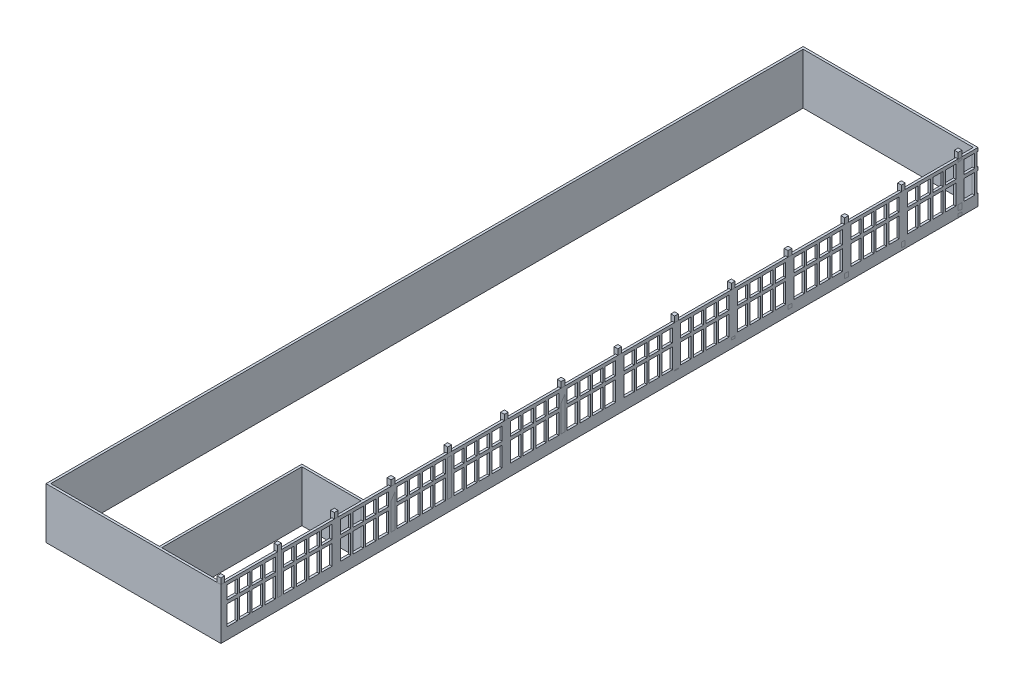
from build123d import *

# Parameters (mm, degrees)
SKETCH1_W                  = 18500
SKETCH1_H                  = 80100
SKETCH1_W_2                = 18000
SKETCH1_H_2                = 79600
BOSS_EXTRUDE1_DEPTH        = 5400
SKETCH3_W                  = 400
SKETCH3_H                  = 400
BOSS_EXTRUDE3_DEPTH        = 6000
LPATTERN1_COUNT            = 14
LPATTERN1_PITCH            = 6000
SKETCH6_W                  = 1100
SKETCH6_H                  = 2100
SKETCH6_H_2                = 1400
CUT_EXTRUDE1_DEPTH         = 1290
LPATTERN2_COUNT            = 4
LPATTERN2_PITCH            = 1340
MIRROR1_COPY_1_SKETCH_W    = 1100
MIRROR1_COPY_1_SKETCH_H    = 2100
MIRROR1_COPY_1_SKETCH_H_2  = 1400
MIRROR1_COPY_1_DEPTH       = 1290
MIRROR1_COPY_2_SKETCH_W    = 1100
MIRROR1_COPY_2_SKETCH_H    = 2100
MIRROR1_COPY_2_SKETCH_H_2  = 1400
MIRROR1_COPY_2_DEPTH       = 1290
MIRROR1_COPY_3_SKETCH_W    = 1100
MIRROR1_COPY_3_SKETCH_H    = 2100
MIRROR1_COPY_3_SKETCH_H_2  = 1400
MIRROR1_COPY_3_DEPTH       = 1290
MIRROR2_COPY_1_SKETCH_W    = 1100
MIRROR2_COPY_1_SKETCH_H    = 2100
MIRROR2_COPY_1_SKETCH_H_2  = 1400
MIRROR2_COPY_1_DEPTH       = 1290
MIRROR2_COPY_2_SKETCH_W    = 1100
MIRROR2_COPY_2_SKETCH_H    = 2100
MIRROR2_COPY_2_SKETCH_H_2  = 1400
MIRROR2_COPY_2_DEPTH       = 1290
MIRROR2_COPY_3_SKETCH_W    = 1100
MIRROR2_COPY_3_SKETCH_H    = 2100
MIRROR2_COPY_3_SKETCH_H_2  = 1400
MIRROR2_COPY_3_DEPTH       = 1290
MIRROR2_COPY_4_SKETCH_W    = 1100
MIRROR2_COPY_4_SKETCH_H    = 2100
MIRROR2_COPY_4_SKETCH_H_2  = 1400
MIRROR2_COPY_4_DEPTH       = 1290
MIRROR2_COPY_5_SKETCH_W    = 1100
MIRROR2_COPY_5_SKETCH_H    = 2100
MIRROR2_COPY_5_SKETCH_H_2  = 1400
MIRROR2_COPY_5_DEPTH       = 1290
MIRROR2_COPY_6_SKETCH_W    = 1100
MIRROR2_COPY_6_SKETCH_H    = 2100
MIRROR2_COPY_6_SKETCH_H_2  = 1400
MIRROR2_COPY_6_DEPTH       = 1290
MIRROR2_COPY_7_SKETCH_W    = 1100
MIRROR2_COPY_7_SKETCH_H    = 2100
MIRROR2_COPY_7_SKETCH_H_2  = 1400
MIRROR2_COPY_7_DEPTH       = 1290
MIRROR3_COPY_1_SKETCH_W    = 1100
MIRROR3_COPY_1_SKETCH_H    = 2100
MIRROR3_COPY_1_SKETCH_H_2  = 1400
MIRROR3_COPY_1_DEPTH       = 1290
MIRROR3_COPY_2_SKETCH_W    = 1100
MIRROR3_COPY_2_SKETCH_H    = 2100
MIRROR3_COPY_2_SKETCH_H_2  = 1400
MIRROR3_COPY_2_DEPTH       = 1290
MIRROR3_COPY_3_SKETCH_W    = 1100
MIRROR3_COPY_3_SKETCH_H    = 2100
MIRROR3_COPY_3_SKETCH_H_2  = 1400
MIRROR3_COPY_3_DEPTH       = 1290
MIRROR3_COPY_4_SKETCH_W    = 1100
MIRROR3_COPY_4_SKETCH_H    = 2100
MIRROR3_COPY_4_SKETCH_H_2  = 1400
MIRROR3_COPY_4_DEPTH       = 1290
MIRROR3_COPY_5_SKETCH_W    = 1100
MIRROR3_COPY_5_SKETCH_H    = 2100
MIRROR3_COPY_5_SKETCH_H_2  = 1400
MIRROR3_COPY_5_DEPTH       = 1290
MIRROR3_COPY_6_SKETCH_W    = 1100
MIRROR3_COPY_6_SKETCH_H    = 2100
MIRROR3_COPY_6_SKETCH_H_2  = 1400
MIRROR3_COPY_6_DEPTH       = 1290
MIRROR3_COPY_7_SKETCH_W    = 1100
MIRROR3_COPY_7_SKETCH_H    = 2100
MIRROR3_COPY_7_SKETCH_H_2  = 1400
MIRROR3_COPY_7_DEPTH       = 1290
MIRROR3_COPY_8_SKETCH_W    = 1100
MIRROR3_COPY_8_SKETCH_H    = 2100
MIRROR3_COPY_8_SKETCH_H_2  = 1400
MIRROR3_COPY_8_DEPTH       = 1290
MIRROR3_COPY_9_SKETCH_W    = 1100
MIRROR3_COPY_9_SKETCH_H    = 2100
MIRROR3_COPY_9_SKETCH_H_2  = 1400
MIRROR3_COPY_9_DEPTH       = 1290
MIRROR3_COPY_10_SKETCH_W   = 1100
MIRROR3_COPY_10_SKETCH_H   = 2100
MIRROR3_COPY_10_SKETCH_H_2 = 1400
MIRROR3_COPY_10_DEPTH      = 1290
MIRROR3_COPY_11_SKETCH_W   = 1100
MIRROR3_COPY_11_SKETCH_H   = 2100
MIRROR3_COPY_11_SKETCH_H_2 = 1400
MIRROR3_COPY_11_DEPTH      = 1290
MIRROR3_COPY_12_SKETCH_W   = 1100
MIRROR3_COPY_12_SKETCH_H   = 2100
MIRROR3_COPY_12_SKETCH_H_2 = 1400
MIRROR3_COPY_12_DEPTH      = 1290
MIRROR3_COPY_13_SKETCH_W   = 1100
MIRROR3_COPY_13_SKETCH_H   = 2100
MIRROR3_COPY_13_SKETCH_H_2 = 1400
MIRROR3_COPY_13_DEPTH      = 1290
MIRROR3_COPY_14_SKETCH_W   = 1100
MIRROR3_COPY_14_SKETCH_H   = 2100
MIRROR3_COPY_14_SKETCH_H_2 = 1400
MIRROR3_COPY_14_DEPTH      = 1290
MIRROR3_COPY_15_SKETCH_W   = 1100
MIRROR3_COPY_15_SKETCH_H   = 2100
MIRROR3_COPY_15_SKETCH_H_2 = 1400
MIRROR3_COPY_15_DEPTH      = 1290
MIRROR4_START              = 1200
MIRROR4_OUTLINE_W          = 250
MIRROR4_OUTLINE_H          = 1100
MIRROR4_OUTLINE_W_2        = 1290
MIRROR4_OUTLINE_H_2        = 120
MIRROR4_DEPTH              = 2100
MIRROR4_START_2            = 3650
MIRROR4_2_OUTLINE_W        = 250
MIRROR4_2_OUTLINE_H        = 1100
MIRROR4_2_OUTLINE_W_2      = 1290
MIRROR4_2_OUTLINE_H_2      = 120
MIRROR4_2_DEPTH            = 1400
BOSS_EXTRUDE5_DEPTH        = 5400


# Read off the part's stored shape, not the designer's step: Mirror4
with BuildPart() as part:
    # Sketch1 → Boss-Extrude1 (new body)
    with BuildSketch(Plane(origin=(0, 0, 0), x_dir=(1, 0, 0), z_dir=(0, 1, 0))):
        with Locations((9000, 39800)):
            Rectangle(SKETCH1_W, SKETCH1_H)
        with Locations((9000, 39800)):
            Rectangle(SKETCH1_W_2, SKETCH1_H_2, mode=Mode.SUBTRACT)
    extrude(amount=BOSS_EXTRUDE1_DEPTH)

    # Sketch6 → Cut-Extrude1 (cut)
    with BuildSketch(Plane(origin=(18250, 0, 0), x_dir=(0, 0, -1), z_dir=(1, 0, 0))):
        with Locations((940, 2250)):
            Rectangle(SKETCH6_W, SKETCH6_H)
        with Locations((940, 4350)):
            Rectangle(SKETCH6_W, SKETCH6_H_2)
    cut_extrude1 = extrude(amount=-CUT_EXTRUDE1_DEPTH, mode=Mode.SUBTRACT)

    # LPattern2: Cut-Extrude1 ×4
    with Locations(*[(0, 0, -i * LPATTERN2_PITCH) for i in range(1, LPATTERN2_COUNT)]):
        add(cut_extrude1, mode=Mode.SUBTRACT)

    # Mirror1: Cut-Extrude1 across plane
    add(cut_extrude1.mirror(Plane(origin=(0, 0, -5950), x_dir=(1, 0, 0), z_dir=(0, 0, -1))), mode=Mode.SUBTRACT)

    # Mirror1 copy 1 sketch → Mirror1 copy 1 (cut)
    with BuildSketch(Plane(origin=(18250, 0, -10560), x_dir=(0, 0, 1), z_dir=(1, 0, 0))):
        with Locations((940, -2250)):
            Rectangle(MIRROR1_COPY_1_SKETCH_W, MIRROR1_COPY_1_SKETCH_H)
        with Locations((940, -4350)):
            Rectangle(MIRROR1_COPY_1_SKETCH_W, MIRROR1_COPY_1_SKETCH_H_2)
    extrude(amount=-MIRROR1_COPY_1_DEPTH, mode=Mode.SUBTRACT)

    # Mirror1 copy 2 sketch → Mirror1 copy 2 (cut)
    with BuildSketch(Plane(origin=(18250, 0, -9220), x_dir=(0, 0, 1), z_dir=(1, 0, 0))):
        with Locations((940, -2250)):
            Rectangle(MIRROR1_COPY_2_SKETCH_W, MIRROR1_COPY_2_SKETCH_H)
        with Locations((940, -4350)):
            Rectangle(MIRROR1_COPY_2_SKETCH_W, MIRROR1_COPY_2_SKETCH_H_2)
    extrude(amount=-MIRROR1_COPY_2_DEPTH, mode=Mode.SUBTRACT)

    # Mirror1 copy 3 sketch → Mirror1 copy 3 (cut)
    with BuildSketch(Plane(origin=(18250, 0, -7880), x_dir=(0, 0, 1), z_dir=(1, 0, 0))):
        with Locations((940, -2250)):
            Rectangle(MIRROR1_COPY_3_SKETCH_W, MIRROR1_COPY_3_SKETCH_H)
        with Locations((940, -4350)):
            Rectangle(MIRROR1_COPY_3_SKETCH_W, MIRROR1_COPY_3_SKETCH_H_2)
    extrude(amount=-MIRROR1_COPY_3_DEPTH, mode=Mode.SUBTRACT)

    # Mirror2: Cut-Extrude1 across plane
    add(cut_extrude1.mirror(Plane.XY.offset(-11950)), mode=Mode.SUBTRACT)

    # Mirror2 copy 1 sketch → Mirror2 copy 1 (cut)
    with BuildSketch(Plane(origin=(18250, 0, -22560), x_dir=(0, 0, 1), z_dir=(1, 0, 0))):
        with Locations((940, -2250)):
            Rectangle(MIRROR2_COPY_1_SKETCH_W, MIRROR2_COPY_1_SKETCH_H)
        with Locations((940, -4350)):
            Rectangle(MIRROR2_COPY_1_SKETCH_W, MIRROR2_COPY_1_SKETCH_H_2)
    extrude(amount=-MIRROR2_COPY_1_DEPTH, mode=Mode.SUBTRACT)

    # Mirror2 copy 2 sketch → Mirror2 copy 2 (cut)
    with BuildSketch(Plane(origin=(18250, 0, -21220), x_dir=(0, 0, 1), z_dir=(1, 0, 0))):
        with Locations((940, -2250)):
            Rectangle(MIRROR2_COPY_2_SKETCH_W, MIRROR2_COPY_2_SKETCH_H)
        with Locations((940, -4350)):
            Rectangle(MIRROR2_COPY_2_SKETCH_W, MIRROR2_COPY_2_SKETCH_H_2)
    extrude(amount=-MIRROR2_COPY_2_DEPTH, mode=Mode.SUBTRACT)

    # Mirror2 copy 3 sketch → Mirror2 copy 3 (cut)
    with BuildSketch(Plane(origin=(18250, 0, -19880), x_dir=(0, 0, 1), z_dir=(1, 0, 0))):
        with Locations((940, -2250)):
            Rectangle(MIRROR2_COPY_3_SKETCH_W, MIRROR2_COPY_3_SKETCH_H)
        with Locations((940, -4350)):
            Rectangle(MIRROR2_COPY_3_SKETCH_W, MIRROR2_COPY_3_SKETCH_H_2)
    extrude(amount=-MIRROR2_COPY_3_DEPTH, mode=Mode.SUBTRACT)

    # Mirror2 copy 4 sketch → Mirror2 copy 4 (cut)
    with BuildSketch(Plane(origin=(18250, 0, -12000), x_dir=(0, 0, -1), z_dir=(1, 0, 0))):
        with Locations((940, 2250)):
            Rectangle(MIRROR2_COPY_4_SKETCH_W, MIRROR2_COPY_4_SKETCH_H)
        with Locations((940, 4350)):
            Rectangle(MIRROR2_COPY_4_SKETCH_W, MIRROR2_COPY_4_SKETCH_H_2)
    extrude(amount=-MIRROR2_COPY_4_DEPTH, mode=Mode.SUBTRACT)

    # Mirror2 copy 5 sketch → Mirror2 copy 5 (cut)
    with BuildSketch(Plane(origin=(18250, 0, -13340), x_dir=(0, 0, -1), z_dir=(1, 0, 0))):
        with Locations((940, 2250)):
            Rectangle(MIRROR2_COPY_5_SKETCH_W, MIRROR2_COPY_5_SKETCH_H)
        with Locations((940, 4350)):
            Rectangle(MIRROR2_COPY_5_SKETCH_W, MIRROR2_COPY_5_SKETCH_H_2)
    extrude(amount=-MIRROR2_COPY_5_DEPTH, mode=Mode.SUBTRACT)

    # Mirror2 copy 6 sketch → Mirror2 copy 6 (cut)
    with BuildSketch(Plane(origin=(18250, 0, -14680), x_dir=(0, 0, -1), z_dir=(1, 0, 0))):
        with Locations((940, 2250)):
            Rectangle(MIRROR2_COPY_6_SKETCH_W, MIRROR2_COPY_6_SKETCH_H)
        with Locations((940, 4350)):
            Rectangle(MIRROR2_COPY_6_SKETCH_W, MIRROR2_COPY_6_SKETCH_H_2)
    extrude(amount=-MIRROR2_COPY_6_DEPTH, mode=Mode.SUBTRACT)

    # Mirror2 copy 7 sketch → Mirror2 copy 7 (cut)
    with BuildSketch(Plane(origin=(18250, 0, -16020), x_dir=(0, 0, -1), z_dir=(1, 0, 0))):
        with Locations((940, 2250)):
            Rectangle(MIRROR2_COPY_7_SKETCH_W, MIRROR2_COPY_7_SKETCH_H)
        with Locations((940, 4350)):
            Rectangle(MIRROR2_COPY_7_SKETCH_W, MIRROR2_COPY_7_SKETCH_H_2)
    extrude(amount=-MIRROR2_COPY_7_DEPTH, mode=Mode.SUBTRACT)

    # Mirror3: Cut-Extrude1 across plane
    add(cut_extrude1.mirror(Plane(origin=(0, 0, -23950), x_dir=(1, 0, 0), z_dir=(0, 0, -1))), mode=Mode.SUBTRACT)

    # Mirror3 copy 1 sketch → Mirror3 copy 1 (cut)
    with BuildSketch(Plane(origin=(18250, 0, -46560), x_dir=(0, 0, 1), z_dir=(1, 0, 0))):
        with Locations((940, -2250)):
            Rectangle(MIRROR3_COPY_1_SKETCH_W, MIRROR3_COPY_1_SKETCH_H)
        with Locations((940, -4350)):
            Rectangle(MIRROR3_COPY_1_SKETCH_W, MIRROR3_COPY_1_SKETCH_H_2)
    extrude(amount=-MIRROR3_COPY_1_DEPTH, mode=Mode.SUBTRACT)

    # Mirror3 copy 2 sketch → Mirror3 copy 2 (cut)
    with BuildSketch(Plane(origin=(18250, 0, -45220), x_dir=(0, 0, 1), z_dir=(1, 0, 0))):
        with Locations((940, -2250)):
            Rectangle(MIRROR3_COPY_2_SKETCH_W, MIRROR3_COPY_2_SKETCH_H)
        with Locations((940, -4350)):
            Rectangle(MIRROR3_COPY_2_SKETCH_W, MIRROR3_COPY_2_SKETCH_H_2)
    extrude(amount=-MIRROR3_COPY_2_DEPTH, mode=Mode.SUBTRACT)

    # Mirror3 copy 3 sketch → Mirror3 copy 3 (cut)
    with BuildSketch(Plane(origin=(18250, 0, -43880), x_dir=(0, 0, 1), z_dir=(1, 0, 0))):
        with Locations((940, -2250)):
            Rectangle(MIRROR3_COPY_3_SKETCH_W, MIRROR3_COPY_3_SKETCH_H)
        with Locations((940, -4350)):
            Rectangle(MIRROR3_COPY_3_SKETCH_W, MIRROR3_COPY_3_SKETCH_H_2)
    extrude(amount=-MIRROR3_COPY_3_DEPTH, mode=Mode.SUBTRACT)

    # Mirror3 copy 4 sketch → Mirror3 copy 4 (cut)
    with BuildSketch(Plane(origin=(18250, 0, -36000), x_dir=(0, 0, -1), z_dir=(1, 0, 0))):
        with Locations((940, 2250)):
            Rectangle(MIRROR3_COPY_4_SKETCH_W, MIRROR3_COPY_4_SKETCH_H)
        with Locations((940, 4350)):
            Rectangle(MIRROR3_COPY_4_SKETCH_W, MIRROR3_COPY_4_SKETCH_H_2)
    extrude(amount=-MIRROR3_COPY_4_DEPTH, mode=Mode.SUBTRACT)

    # Mirror3 copy 5 sketch → Mirror3 copy 5 (cut)
    with BuildSketch(Plane(origin=(18250, 0, -37340), x_dir=(0, 0, -1), z_dir=(1, 0, 0))):
        with Locations((940, 2250)):
            Rectangle(MIRROR3_COPY_5_SKETCH_W, MIRROR3_COPY_5_SKETCH_H)
        with Locations((940, 4350)):
            Rectangle(MIRROR3_COPY_5_SKETCH_W, MIRROR3_COPY_5_SKETCH_H_2)
    extrude(amount=-MIRROR3_COPY_5_DEPTH, mode=Mode.SUBTRACT)

    # Mirror3 copy 6 sketch → Mirror3 copy 6 (cut)
    with BuildSketch(Plane(origin=(18250, 0, -38680), x_dir=(0, 0, -1), z_dir=(1, 0, 0))):
        with Locations((940, 2250)):
            Rectangle(MIRROR3_COPY_6_SKETCH_W, MIRROR3_COPY_6_SKETCH_H)
        with Locations((940, 4350)):
            Rectangle(MIRROR3_COPY_6_SKETCH_W, MIRROR3_COPY_6_SKETCH_H_2)
    extrude(amount=-MIRROR3_COPY_6_DEPTH, mode=Mode.SUBTRACT)

    # Mirror3 copy 7 sketch → Mirror3 copy 7 (cut)
    with BuildSketch(Plane(origin=(18250, 0, -40020), x_dir=(0, 0, -1), z_dir=(1, 0, 0))):
        with Locations((940, 2250)):
            Rectangle(MIRROR3_COPY_7_SKETCH_W, MIRROR3_COPY_7_SKETCH_H)
        with Locations((940, 4350)):
            Rectangle(MIRROR3_COPY_7_SKETCH_W, MIRROR3_COPY_7_SKETCH_H_2)
    extrude(amount=-MIRROR3_COPY_7_DEPTH, mode=Mode.SUBTRACT)

    # Mirror3 copy 8 sketch → Mirror3 copy 8 (cut)
    with BuildSketch(Plane(origin=(18250, 0, -24000), x_dir=(0, 0, -1), z_dir=(1, 0, 0))):
        with Locations((940, 2250)):
            Rectangle(MIRROR3_COPY_8_SKETCH_W, MIRROR3_COPY_8_SKETCH_H)
        with Locations((940, 4350)):
            Rectangle(MIRROR3_COPY_8_SKETCH_W, MIRROR3_COPY_8_SKETCH_H_2)
    extrude(amount=-MIRROR3_COPY_8_DEPTH, mode=Mode.SUBTRACT)

    # Mirror3 copy 9 sketch → Mirror3 copy 9 (cut)
    with BuildSketch(Plane(origin=(18250, 0, -25340), x_dir=(0, 0, -1), z_dir=(1, 0, 0))):
        with Locations((940, 2250)):
            Rectangle(MIRROR3_COPY_9_SKETCH_W, MIRROR3_COPY_9_SKETCH_H)
        with Locations((940, 4350)):
            Rectangle(MIRROR3_COPY_9_SKETCH_W, MIRROR3_COPY_9_SKETCH_H_2)
    extrude(amount=-MIRROR3_COPY_9_DEPTH, mode=Mode.SUBTRACT)

    # Mirror3 copy 10 sketch → Mirror3 copy 10 (cut)
    with BuildSketch(Plane(origin=(18250, 0, -26680), x_dir=(0, 0, -1), z_dir=(1, 0, 0))):
        with Locations((940, 2250)):
            Rectangle(MIRROR3_COPY_10_SKETCH_W, MIRROR3_COPY_10_SKETCH_H)
        with Locations((940, 4350)):
            Rectangle(MIRROR3_COPY_10_SKETCH_W, MIRROR3_COPY_10_SKETCH_H_2)
    extrude(amount=-MIRROR3_COPY_10_DEPTH, mode=Mode.SUBTRACT)

    # Mirror3 copy 11 sketch → Mirror3 copy 11 (cut)
    with BuildSketch(Plane(origin=(18250, 0, -28020), x_dir=(0, 0, -1), z_dir=(1, 0, 0))):
        with Locations((940, 2250)):
            Rectangle(MIRROR3_COPY_11_SKETCH_W, MIRROR3_COPY_11_SKETCH_H)
        with Locations((940, 4350)):
            Rectangle(MIRROR3_COPY_11_SKETCH_W, MIRROR3_COPY_11_SKETCH_H_2)
    extrude(amount=-MIRROR3_COPY_11_DEPTH, mode=Mode.SUBTRACT)

    # Mirror3 copy 12 sketch → Mirror3 copy 12 (cut)
    with BuildSketch(Plane(origin=(18250, 0, -35900), x_dir=(0, 0, 1), z_dir=(1, 0, 0))):
        with Locations((940, -2250)):
            Rectangle(MIRROR3_COPY_12_SKETCH_W, MIRROR3_COPY_12_SKETCH_H)
        with Locations((940, -4350)):
            Rectangle(MIRROR3_COPY_12_SKETCH_W, MIRROR3_COPY_12_SKETCH_H_2)
    extrude(amount=-MIRROR3_COPY_12_DEPTH, mode=Mode.SUBTRACT)

    # Mirror3 copy 13 sketch → Mirror3 copy 13 (cut)
    with BuildSketch(Plane(origin=(18250, 0, -34560), x_dir=(0, 0, 1), z_dir=(1, 0, 0))):
        with Locations((940, -2250)):
            Rectangle(MIRROR3_COPY_13_SKETCH_W, MIRROR3_COPY_13_SKETCH_H)
        with Locations((940, -4350)):
            Rectangle(MIRROR3_COPY_13_SKETCH_W, MIRROR3_COPY_13_SKETCH_H_2)
    extrude(amount=-MIRROR3_COPY_13_DEPTH, mode=Mode.SUBTRACT)

    # Mirror3 copy 14 sketch → Mirror3 copy 14 (cut)
    with BuildSketch(Plane(origin=(18250, 0, -33220), x_dir=(0, 0, 1), z_dir=(1, 0, 0))):
        with Locations((940, -2250)):
            Rectangle(MIRROR3_COPY_14_SKETCH_W, MIRROR3_COPY_14_SKETCH_H)
        with Locations((940, -4350)):
            Rectangle(MIRROR3_COPY_14_SKETCH_W, MIRROR3_COPY_14_SKETCH_H_2)
    extrude(amount=-MIRROR3_COPY_14_DEPTH, mode=Mode.SUBTRACT)

    # Mirror3 copy 15 sketch → Mirror3 copy 15 (cut)
    with BuildSketch(Plane(origin=(18250, 0, -31880), x_dir=(0, 0, 1), z_dir=(1, 0, 0))):
        with Locations((940, -2250)):
            Rectangle(MIRROR3_COPY_15_SKETCH_W, MIRROR3_COPY_15_SKETCH_H)
        with Locations((940, -4350)):
            Rectangle(MIRROR3_COPY_15_SKETCH_W, MIRROR3_COPY_15_SKETCH_H_2)
    extrude(amount=-MIRROR3_COPY_15_DEPTH, mode=Mode.SUBTRACT)

    # Mirror4 outline → Mirror4 (cut)
    with BuildSketch(Plane(origin=(0, 0, 0), x_dir=(1, 0, 0), z_dir=(0, 1, 0)).offset(MIRROR4_START)):
        with Locations((18125, 60940)):
            Rectangle(MIRROR4_OUTLINE_W, MIRROR4_OUTLINE_H)
        with Locations((17605, 79790)):
            Rectangle(MIRROR4_OUTLINE_W_2, MIRROR4_OUTLINE_H_2)
        with Locations((18125, 58960)):
            Rectangle(MIRROR4_OUTLINE_W, MIRROR4_OUTLINE_H)
        with Locations((18125, 62280)):
            Rectangle(MIRROR4_OUTLINE_W, MIRROR4_OUTLINE_H)
        with Locations((18125, 57620)):
            Rectangle(MIRROR4_OUTLINE_W, MIRROR4_OUTLINE_H)
        with Locations((18125, 63620)):
            Rectangle(MIRROR4_OUTLINE_W, MIRROR4_OUTLINE_H)
        with Locations((18125, 56280)):
            Rectangle(MIRROR4_OUTLINE_W, MIRROR4_OUTLINE_H)
        with Locations((18125, 64960)):
            Rectangle(MIRROR4_OUTLINE_W, MIRROR4_OUTLINE_H)
        with Locations((18125, 54940)):
            Rectangle(MIRROR4_OUTLINE_W, MIRROR4_OUTLINE_H)
        with Locations((18125, 66940)):
            Rectangle(MIRROR4_OUTLINE_W, MIRROR4_OUTLINE_H)
        with Locations((18125, 52960)):
            Rectangle(MIRROR4_OUTLINE_W, MIRROR4_OUTLINE_H)
        with Locations((18125, 68280)):
            Rectangle(MIRROR4_OUTLINE_W, MIRROR4_OUTLINE_H)
        with Locations((18125, 51620)):
            Rectangle(MIRROR4_OUTLINE_W, MIRROR4_OUTLINE_H)
        with Locations((18125, 69620)):
            Rectangle(MIRROR4_OUTLINE_W, MIRROR4_OUTLINE_H)
        with Locations((18125, 50280)):
            Rectangle(MIRROR4_OUTLINE_W, MIRROR4_OUTLINE_H)
        with Locations((18125, 70960)):
            Rectangle(MIRROR4_OUTLINE_W, MIRROR4_OUTLINE_H)
        with Locations((18125, 48940)):
            Rectangle(MIRROR4_OUTLINE_W, MIRROR4_OUTLINE_H)
        with Locations((18125, 72940)):
            Rectangle(MIRROR4_OUTLINE_W, MIRROR4_OUTLINE_H)
        with Locations((18125, 74280)):
            Rectangle(MIRROR4_OUTLINE_W, MIRROR4_OUTLINE_H)
        with Locations((18125, 75620)):
            Rectangle(MIRROR4_OUTLINE_W, MIRROR4_OUTLINE_H)
        with Locations((18125, 76960)):
            Rectangle(MIRROR4_OUTLINE_W, MIRROR4_OUTLINE_H)
        with Locations((18125, 78940)):
            Rectangle(MIRROR4_OUTLINE_W, MIRROR4_OUTLINE_H)
    extrude(amount=MIRROR4_DEPTH, mode=Mode.SUBTRACT)

    # Mirror4 2 outline → Mirror4 2 (cut)
    with BuildSketch(Plane(origin=(0, 0, 0), x_dir=(1, 0, 0), z_dir=(0, 1, 0)).offset(MIRROR4_START_2)):
        with Locations((18125, 60940)):
            Rectangle(MIRROR4_2_OUTLINE_W, MIRROR4_2_OUTLINE_H)
        with Locations((17605, 79790)):
            Rectangle(MIRROR4_2_OUTLINE_W_2, MIRROR4_2_OUTLINE_H_2)
        with Locations((18125, 58960)):
            Rectangle(MIRROR4_2_OUTLINE_W, MIRROR4_2_OUTLINE_H)
        with Locations((18125, 62280)):
            Rectangle(MIRROR4_2_OUTLINE_W, MIRROR4_2_OUTLINE_H)
        with Locations((18125, 57620)):
            Rectangle(MIRROR4_2_OUTLINE_W, MIRROR4_2_OUTLINE_H)
        with Locations((18125, 63620)):
            Rectangle(MIRROR4_2_OUTLINE_W, MIRROR4_2_OUTLINE_H)
        with Locations((18125, 56280)):
            Rectangle(MIRROR4_2_OUTLINE_W, MIRROR4_2_OUTLINE_H)
        with Locations((18125, 64960)):
            Rectangle(MIRROR4_2_OUTLINE_W, MIRROR4_2_OUTLINE_H)
        with Locations((18125, 54940)):
            Rectangle(MIRROR4_2_OUTLINE_W, MIRROR4_2_OUTLINE_H)
        with Locations((18125, 66940)):
            Rectangle(MIRROR4_2_OUTLINE_W, MIRROR4_2_OUTLINE_H)
        with Locations((18125, 52960)):
            Rectangle(MIRROR4_2_OUTLINE_W, MIRROR4_2_OUTLINE_H)
        with Locations((18125, 68280)):
            Rectangle(MIRROR4_2_OUTLINE_W, MIRROR4_2_OUTLINE_H)
        with Locations((18125, 51620)):
            Rectangle(MIRROR4_2_OUTLINE_W, MIRROR4_2_OUTLINE_H)
        with Locations((18125, 69620)):
            Rectangle(MIRROR4_2_OUTLINE_W, MIRROR4_2_OUTLINE_H)
        with Locations((18125, 50280)):
            Rectangle(MIRROR4_2_OUTLINE_W, MIRROR4_2_OUTLINE_H)
        with Locations((18125, 70960)):
            Rectangle(MIRROR4_2_OUTLINE_W, MIRROR4_2_OUTLINE_H)
        with Locations((18125, 48940)):
            Rectangle(MIRROR4_2_OUTLINE_W, MIRROR4_2_OUTLINE_H)
        with Locations((18125, 72940)):
            Rectangle(MIRROR4_2_OUTLINE_W, MIRROR4_2_OUTLINE_H)
        with Locations((18125, 74280)):
            Rectangle(MIRROR4_2_OUTLINE_W, MIRROR4_2_OUTLINE_H)
        with Locations((18125, 75620)):
            Rectangle(MIRROR4_2_OUTLINE_W, MIRROR4_2_OUTLINE_H)
        with Locations((18125, 76960)):
            Rectangle(MIRROR4_2_OUTLINE_W, MIRROR4_2_OUTLINE_H)
        with Locations((18125, 78940)):
            Rectangle(MIRROR4_2_OUTLINE_W, MIRROR4_2_OUTLINE_H)
    extrude(amount=MIRROR4_2_DEPTH, mode=Mode.SUBTRACT)


with BuildPart() as body_2:
    # Sketch3 → Boss-Extrude3 (new body)
    with BuildSketch(Plane(origin=(0, 0, 0), x_dir=(1, 0, 0), z_dir=(0, 1, 0))):
        with Locations((18050, -50)):
            Rectangle(SKETCH3_W, SKETCH3_H)
    boss_extrude3 = extrude(amount=BOSS_EXTRUDE3_DEPTH)


with BuildPart() as lpattern1_1:
    # LPattern1: Boss-Extrude3 ×14
    with Locations(*[(0, 0, -i * LPATTERN1_PITCH) for i in range(1, LPATTERN1_COUNT)]):
        add(boss_extrude3)


with BuildPart() as body_16:
    # Sketch10 → Boss-Extrude5 (new body)
    with BuildSketch(Plane(origin=(0, 0, 0), x_dir=(1, 0, 0), z_dir=(0, 1, 0))):
        Polygon((11500, 0), (11500, 15070), (18000, 15070), (18000, 14830), (11740, 14830), (11740, 0), align=None)
    extrude(amount=BOSS_EXTRUDE5_DEPTH)


solid = Compound([part.part, body_2.part, lpattern1_1.part, body_16.part])
